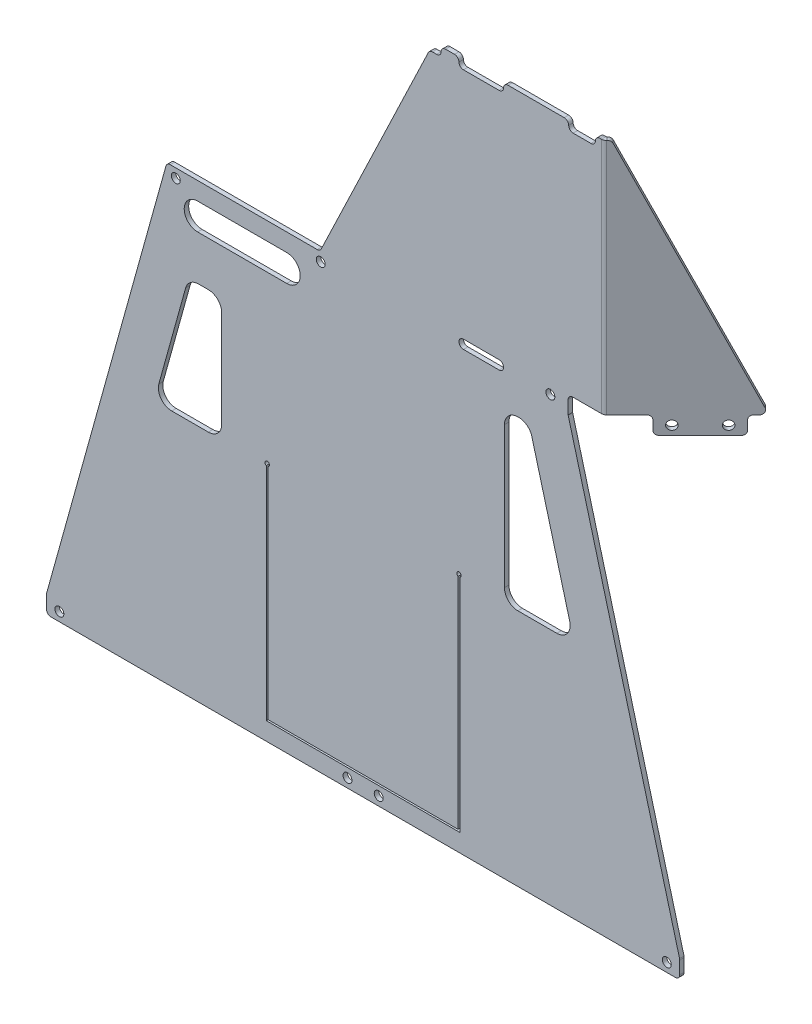
from build123d import *

# Parameters (mm, degrees)
SM_BASE_FLANGE_1_DEPTH      = 266.5
SM_BASE_FLANGE_1_DEPTH_BACK = 20
EXTRUDE_2_DEPTH             = 5
CUT_EXTRUDE_1_DEPTH         = 781.997587301
SKETCH_16_R                 = 5
CUT_EXTRUDE_6_DEPTH         = 804.201519225
CUT_EXTRUDE_7_DEPTH         = 780.82164677
SKETCH_18_W                 = 41.523044305
SKETCH_18_H                 = 20
SKETCH_18_R                 = 5
CUT_EXTRUDE_8_DEPTH         = 780.82164677
CUT_EXTRUDE_9_DEPTH         = 5
CUT_EXTRUDE_10_DEPTH        = 780.82164677
FILLET_1_R                  = 5
FILLET_2_R                  = 15
FILLET_3_R                  = 5


# Sheet-metal steps are written as plain solids
with BuildPart() as part:
    # Sketch 1 → ﾍﾞｰｽ-ﾌﾗﾝｼﾞ1 (new, two sides: drawn at the far end of the back side and taken through both)
    with BuildSketch(Plane(origin=(0, 0, 0), x_dir=(1, 0, 0), z_dir=(0, 1, 0)).offset(-SM_BASE_FLANGE_1_DEPTH_BACK)):
        with BuildLine():
            Line((137.550775542, 90.408639918), (37.357880769, -9.784254855))
            ThreePointArc((37.357880769, -9.784254855), (37.11891053, -9.943929664), (36.837025914, -10))
            Line((36.837025914, -10), (30, -10))
            Line((30, -10), (-450.5, -10))
            Line((-450.5, -10), (-450.5, -15))
            Line((-450.5, -15), (30, -15))
            Line((30, -15), (36.837025914, -15))
            ThreePointArc((36.837025914, -15), (39.032327692, -14.563327326), (40.893414675, -13.319788761))
            Line((40.893414675, -13.319788761), (141.086309448, 86.873106012))
            Line((141.086309448, 86.873106012), (137.550775542, 90.408639918))
        make_face()
    extrude(amount=SM_BASE_FLANGE_1_DEPTH + SM_BASE_FLANGE_1_DEPTH_BACK)

    # ｽｹｯﾁ15 → ﾎﾞｽ - 押し出し2 (add)
    with BuildSketch(Plane.XY.offset(15)):
        Polygon((-450.5, 0), (-585.5, -486), (-585.5, -506), (124.5, -506), (124.5, -486), (-6, 0), align=None)
    extrude(amount=-EXTRUDE_2_DEPTH)

    # ｽｹｯﾁ7 → ｶｯﾄ - 押し出し1 (cut, through all)
    with BuildSketch(Plane.XY.offset(15)):
        Polygon((-278.755408603, 0), (-151.149515417, 266.5), (-450.5, 266.5), (-450.5, 0), align=None)
    extrude(amount=-CUT_EXTRUDE_1_DEPTH, mode=Mode.SUBTRACT)

    # ｽｹｯﾁ16 → ｶｯﾄ - 押し出し6 (cut, through all)
    with BuildSketch(Plane(origin=(27.106601718, 0, 27.106601718), x_dir=(0.7071067811865438, 0, -0.7071067811865513), z_dir=(0.7071067811865513, 0, 0.7071067811865438))):
        with BuildLine():
            Line((23.323748893, 266.5), (148.323748893, 0))
            Line((148.323748893, 0), (136.191648507, 0))
            ThreePointArc((136.191648507, 0), (132.656114601, -1.464466094), (131.191648507, -5))
            Line((131.191648507, -5), (131.191648507, -20))
            Line((131.191648507, -20), (141.191648507, -20))
            Line((141.191648507, -20), (161.191648507, -20))
            Line((161.191648507, -20), (161.191648507, 266.5))
            Line((161.191648507, 266.5), (23.323748893, 266.5))
        make_face()
        with BuildLine():
            Line((51.191648507, 0), (19.497497865, 0))
            Line((19.497497865, 0), (19.497497865, -20))
            Line((19.497497865, -20), (46.191648507, -20))
            Line((46.191648507, -20), (56.191648507, -20))
            Line((56.191648507, -20), (56.191648507, -5))
            ThreePointArc((56.191648507, -5), (54.727182413, -1.464466094), (51.191648507, 0))
        make_face()
        with Locations(Location((116.191648507, -10, 0), (0, 0, 180))):
            Circle(SKETCH_16_R)
        with Locations(Location((71.191648507, -10, 0), (0, 0, 180))):
            Circle(SKETCH_16_R)
    extrude(amount=-CUT_EXTRUDE_6_DEPTH, mode=Mode.SUBTRACT)

    # ｽｹｯﾁ17 → ｶｯﾄ - 押し出し7 (cut, through all)
    with BuildSketch(Plane.XY.offset(15)):
        with BuildLine():
            Line((-416.055555556, -20), (-316.055555556, -20))
            ThreePointArc((-316.055555556, -20), (-301.055555556, -35), (-316.055555556, -50))
            Line((-316.055555556, -50), (-416.055555556, -50))
            ThreePointArc((-416.055555556, -50), (-431.055555556, -35), (-416.055555556, -20))
        make_face()
    extrude(amount=-CUT_EXTRUDE_7_DEPTH, mode=Mode.SUBTRACT)

    # ｽｹｯﾁ18 → ｶｯﾄ - 押し出し8 (cut, through all)
    with BuildSketch(Plane.XY.offset(15)):
        with BuildLine():
            Line((-78, -5), (-118, -5))
            ThreePointArc((-118, -5), (-123, -10), (-118, -15))
            Line((-118, -15), (-78, -15))
            ThreePointArc((-78, -15), (-73, -10), (-78, -5))
        make_face()
        with BuildLine():
            Line((-123, 266.5), (-123, 261.5))
            ThreePointArc((-123, 261.5), (-121.535533906, 257.964466094), (-118, 256.5))
            Line((-118, 256.5), (-78, 256.5))
            ThreePointArc((-78, 256.5), (-74.464466094, 257.964466094), (-73, 261.5))
            Line((-73, 261.5), (-73, 266.5))
            Line((-73, 266.5), (-123, 266.5))
        make_face()
        with BuildLine():
            ThreePointArc((0, 261.5), (1.464466094, 257.964466094), (5, 256.5))
            Line((5, 256.5), (25, 256.5))
            ThreePointArc((25, 256.5), (28.535533906, 257.964466094), (30, 261.5))
            Line((30, 261.5), (30, 266.5))
            Line((30, 266.5), (0, 266.5))
            Line((0, 266.5), (0, 261.5))
        make_face()
        with BuildLine():
            Line((-143, 266.5), (-151.149515417, 266.5))
            Line((-151.149515417, 266.5), (-155.937729045, 256.5))
            Line((-155.937729045, 256.5), (-148, 256.5))
            ThreePointArc((-148, 256.5), (-144.464466094, 257.964466094), (-143, 261.5))
            Line((-143, 261.5), (-143, 266.5))
        make_face()
        with Locations((20.131892523, -10)):
            Rectangle(SKETCH_18_W, SKETCH_18_H)
        with Locations(Location((110, -496, 0), (0, 0, 180))):
            Circle(SKETCH_18_R)
        with Locations(Location((-571, -496, 0), (0, 0, 180))):
            Circle(SKETCH_18_R)
        with Locations(Location((-213, -496, 0), (0, 0, 180))):
            Circle(SKETCH_18_R)
        with Locations(Location((-248, -496, 0), (0, 0, 180))):
            Circle(SKETCH_18_R)
        with Locations(Location((-440.5, -10, 0), (0, 0, 180))):
            Circle(SKETCH_18_R)
        with Locations(Location((-20.5, -10, 0), (0, 0, 180))):
            Circle(SKETCH_18_R)
        with Locations(Location((-278, -10, 0), (0, 0, 180))):
            Circle(SKETCH_18_R)
    extrude(amount=-CUT_EXTRUDE_8_DEPTH, mode=Mode.SUBTRACT)

    # ｽｹｯﾁ24 → ｶｯﾄ - 押し出し9 (cut)
    with BuildSketch(Plane.XY.offset(15)):
        with BuildLine():
            ThreePointArc((-337, -238.291287847), (-338, -233.5), (-339, -238.291287847))
            Line((-339, -238.291287847), (-339, -486))
            Line((-339, -486), (-122, -486))
            Line((-122, -486), (-122, -238.291287847))
            ThreePointArc((-122, -238.291287847), (-123, -233.5), (-124, -238.291287847))
            Line((-124, -238.291287847), (-124, -484))
            Line((-124, -484), (-337, -484))
            Line((-337, -484), (-337, -238.291287847))
        make_face()
    extrude(amount=-CUT_EXTRUDE_9_DEPTH, mode=Mode.SUBTRACT)

    # ｽｹｯﾁ25 → ｶｯﾄ - 押し出し10 (cut, through all)
    with BuildSketch(Plane.XY.offset(15)):
        Polygon((-44.345258018, -50), (-72, -50), (-72, -238.291287847), (6.214439645, -238.291287847), align=None)
        Polygon((-389, -238.291287847), (-389, -100), (-426.38460641, -100), (-464.798853035, -238.291287847), align=None)
    extrude(amount=-CUT_EXTRUDE_10_DEPTH, mode=Mode.SUBTRACT)

    # ﾌｨﾚｯﾄ1
    fillet_1_edges = [part.edges().sort_by_distance(p)[0] for p in [
        (-0.62962963, 0, 12.5),
    ]]
    fillet(fillet_1_edges, radius=FILLET_1_R)

    # ﾌｨﾚｯﾄ2
    fillet_2_edges = [part.edges().sort_by_distance(p)[0] for p in [
        (-389, -238.291287847, 12.5),
        (-464.798853035, -238.291287847, 12.5),
        (-426.38460641, -100, 12.5),
        (-389, -100, 12.5),
        (-72, -238.291287847, 12.5),
        (-72, -50, 12.5),
        (-44.345258018, -50, 12.5),
        (6.214439645, -238.291287847, 12.5),
    ]]
    fillet(fillet_2_edges, radius=FILLET_2_R)

    # ﾌｨﾚｯﾄ3
    fillet_3_edges = [part.edges().sort_by_distance(p)[0] for p in [
        (-155.937729045, 256.5, 12.5),
        (-143, 266.5, 12.5),
        (-123, 266.5, 12.5),
        (-73, 266.5, 12.5),
        (0, 266.5, 12.5),
        (30, 266.5, 12.5),
        (41.831215769, 266.5, 8.84645376),
        (130.219563418, 0, -79.541893888),
        (118.105339059, -20, -67.42766953),
        (65.07233047, -20, -14.394660941),
        (124.5, -486, 12.5),
        (124.5, -506, 12.5),
        (-585.5, -506, 12.5),
        (-585.5, -486, 12.5),
        (-450.5, 0, 12.5),
        (-278.755408603, 0, 12.5),
    ]]
    fillet(fillet_3_edges, radius=FILLET_3_R - 0.0001)  # a hair under: the kernel refuses the full size


solid = part.part
